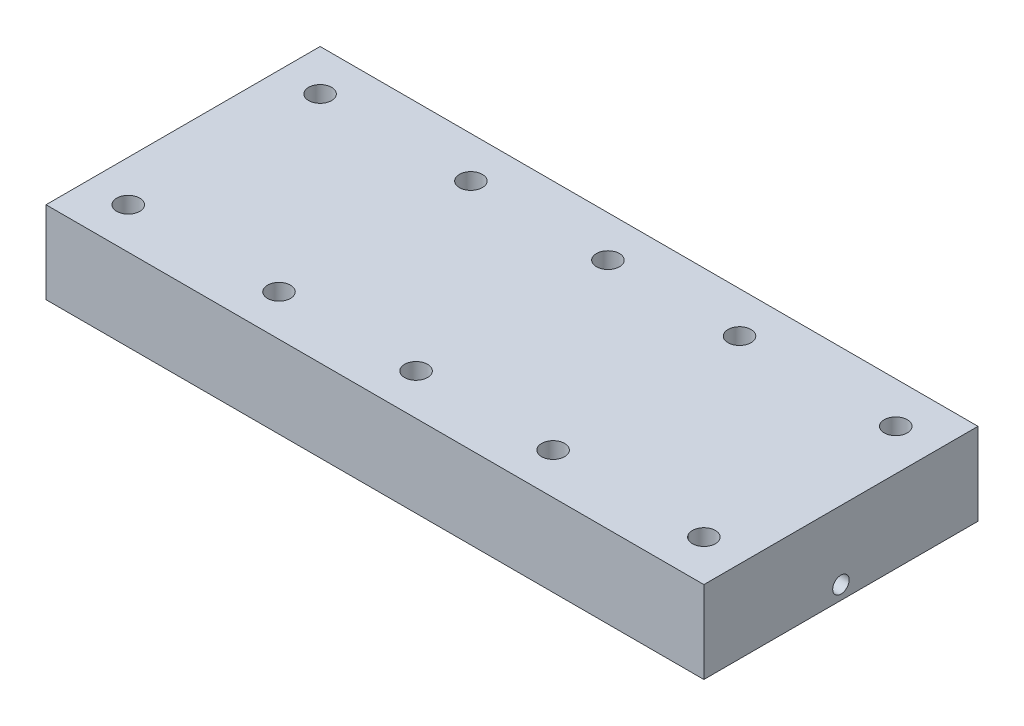
from build123d import *

# Parameters (mm, degrees)
SKETCH2_W                       = 120
SKETCH2_H                       = 50
BOSS_EXTRUDE1_DEPTH             = 15
SKIZZE7_R                       = 1.5
SCHNITT_LINEAR_AUSTRAGEN6_DEPTH = 10
SKIZZE10_W                      = 12.5
SKIZZE10_H                      = 1.5
ROTATION3_ANGLE                 = 180
SKIZZE11_W                      = 12.5
SKIZZE11_H                      = 1.5
ROTATION4_ANGLE                 = 180
SKIZZE12_R                      = 2.1
SCHNITT_LINEAR_AUSTRAGEN7_DEPTH = 83.233536557
CUT_EXTRUDE1_DEPTH              = 25
CUT_EXTRUDE1_DEPTH_BACK         = 10
SKETCH4_R                       = 2.1
CUT_EXTRUDE2_START              = -25
SKETCH5_R                       = 1.5
CUT_EXTRUDE2_DEPTH              = 25
FILLET2_R                       = 1
FILLET3_R                       = 1
FILLET4_R                       = 1
FILLET5_R                       = 1
FILLET7_R                       = 1
FILLET8_R                       = 1
FILLET9_R                       = 1
FILLET10_R                      = 1
FILLET11_R                      = 1
FILLET12_R                      = 1


with BuildPart() as part:
    # Sketch2 → Boss-Extrude1 (new body)
    with BuildSketch(Plane(origin=(0, 0, 0), x_dir=(1, 0, 0), z_dir=(0, 1, 0))):
        with Locations((13.101876656, 9.54663752)):
            Rectangle(SKETCH2_W, SKETCH2_H)
    extrude(amount=BOSS_EXTRUDE1_DEPTH)

    # Skizze7 → Schnitt-Linear austragen6 (cut)
    with BuildSketch(Plane.ZY.offset(46.898123344)):
        with Locations((-9.54663752, 2.5)):
            Circle(SKIZZE7_R)
    extrude(amount=-SCHNITT_LINEAR_AUSTRAGEN6_DEPTH, mode=Mode.SUBTRACT)

    # Sketch3 → Schnitt-Rotation1 (revolve, cut)
    with BuildSketch(Plane(origin=(0, 0, 0), x_dir=(1, 0, 0), z_dir=(0, 1, 0))):
        Polygon((63.101876656, 9.54663752), (63.101876656, 17.04663752), (3.101876656, 17.04663752), (3.101876656, 19.54663752), (-36.898123344, 19.54663752), (-36.898123344, 9.54663752), align=None)
    revolve(axis=Axis((74.354835368, 0, -9.54663752), (-1, 0, 0)), mode=Mode.SUBTRACT)

    # Skizze10 → Rotation3 (revolve)
    with BuildSketch(Plane.XZ):
        with Locations((46.851876656, -16.29663752)):
            Rectangle(SKIZZE10_W, SKIZZE10_H)
    revolve(axis=Axis((85.744816074, 0, -9.54663752), (1, 0, 0)), revolution_arc=ROTATION3_ANGLE)

    # Skizze11 → Rotation4 (revolve)
    with BuildSketch(Plane.XZ):
        with Locations((21.851876656, -16.29663752)):
            Rectangle(SKIZZE11_W, SKIZZE11_H)
    revolve(axis=Axis((95.037830494, 0, -9.54663752), (1, 0, 0)), revolution_arc=ROTATION4_ANGLE)

    # Skizze12 → Schnitt-Linear austragen7 (cut, through all)
    with BuildSketch(Plane.XZ):
        with Locations((-39.398123344, 7.95336248)):
            Circle(SKIZZE12_R)
        with Locations((13.101876656, 7.95336248)):
            Circle(SKIZZE12_R)
        with Locations((65.601876656, 7.95336248)):
            Circle(SKIZZE12_R)
    schnitt_linear_austragen7 = extrude(amount=-SCHNITT_LINEAR_AUSTRAGEN7_DEPTH, mode=Mode.SUBTRACT)

    # Spiegeln1: Schnitt-Linear austragen7 across plane
    add(schnitt_linear_austragen7.mirror(Plane.XY.offset(-9.54663752)), mode=Mode.SUBTRACT)

    # Sketch4 → Cut-Extrude1 (cut, two sides: drawn at the far end of the back side and taken through both)
    with BuildSketch(Plane(origin=(0, 0, 0), x_dir=(1, 0, 0), z_dir=(0, 1, 0)).offset(-CUT_EXTRUDE1_DEPTH_BACK)):
        with Locations((-11.898123344, 27.04663752)):
            Circle(SKETCH4_R)
        with Locations((37.101876656, 27.04663752)):
            Circle(SKETCH4_R)
        with Locations((38.101876656, -7.95336248)):
            Circle(SKETCH4_R)
        with Locations((-11.898123344, -7.95336248)):
            Circle(SKETCH4_R)
    extrude(amount=CUT_EXTRUDE1_DEPTH + CUT_EXTRUDE1_DEPTH_BACK, mode=Mode.SUBTRACT)

    # Sketch5 → Cut-Extrude2 (cut)
    with BuildSketch(Plane(origin=(83.101876656, 0, 0), x_dir=(0, 0, -1), z_dir=(1, 0, 0)).offset(CUT_EXTRUDE2_START)):
        with Locations((9.54663752, 2.5)):
            Circle(SKETCH5_R)
    extrude(amount=CUT_EXTRUDE2_DEPTH, mode=Mode.SUBTRACT)

    # Fillet2
    fillet2_edges = [part.edges().sort_by_distance(p)[0] for p in [
        (3.101876656, 10, -9.54663752),
    ]]
    fillet(fillet2_edges, radius=FILLET2_R)

    # Fillet3
    fillet3_edges = [part.edges().sort_by_distance(p)[0] for p in [
        (3.101876656, 7.5, -9.54663752),
    ]]
    fillet(fillet3_edges, radius=FILLET3_R)

    # Fillet4
    fillet4_edges = [part.edges().sort_by_distance(p)[0] for p in [
        (15.601876656, 7.5, -9.54663752),
    ]]
    fillet(fillet4_edges, radius=FILLET4_R)

    # Fillet5
    fillet5_edges = [part.edges().sort_by_distance(p)[0] for p in [
        (15.601876656, 6, -9.54663752),
    ]]
    fillet(fillet5_edges, radius=FILLET5_R)

    # Fillet7
    fillet7_edges = [part.edges().sort_by_distance(p)[0] for p in [
        (28.101876656, 6, -9.54663752),
    ]]
    fillet(fillet7_edges, radius=FILLET7_R)

    # Fillet8
    fillet8_edges = [part.edges().sort_by_distance(p)[0] for p in [
        (28.101876656, 7.5, -9.54663752),
    ]]
    fillet(fillet8_edges, radius=FILLET8_R)

    # Fillet9
    fillet9_edges = [part.edges().sort_by_distance(p)[0] for p in [
        (40.601876656, 7.5, -9.54663752),
    ]]
    fillet(fillet9_edges, radius=FILLET9_R)

    # Fillet10
    fillet10_edges = [part.edges().sort_by_distance(p)[0] for p in [
        (40.601876656, 6, -9.54663752),
    ]]
    fillet(fillet10_edges, radius=FILLET10_R)

    # Fillet11
    fillet11_edges = [part.edges().sort_by_distance(p)[0] for p in [
        (53.101876656, 6, -9.54663752),
    ]]
    fillet(fillet11_edges, radius=FILLET11_R)

    # Fillet12
    fillet12_edges = [part.edges().sort_by_distance(p)[0] for p in [
        (53.101876656, 7.5, -9.54663752),
    ]]
    fillet(fillet12_edges, radius=FILLET12_R)


solid = part.part
